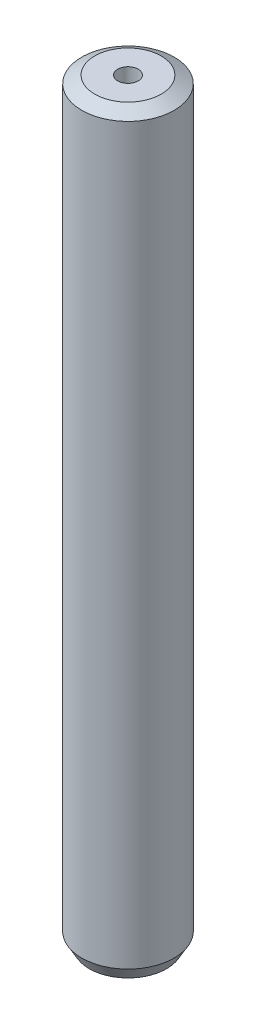
from build123d import *
from OCP.BRepFilletAPI import BRepFilletAPI_MakeChamfer

# Parameters (mm, degrees)
SKETCH1_R           = 7.5
BOSS_EXTRUDE1_DEPTH = 122.534306762
SKETCH2_R           = 1.661700774
CUT_EXTRUDE1_DEPTH  = 123.992505193
CHAMFER1_SIZE       = 1.219381404
CHAMFER1_SIZE2      = 2.112030545


with BuildPart() as part:
    # Sketch1 → Boss-Extrude1 (new body)
    with BuildSketch(Plane(origin=(0, 0, 0), x_dir=(1, 0, 0), z_dir=(0, 1, 0))):
        Circle(SKETCH1_R)
    extrude(amount=BOSS_EXTRUDE1_DEPTH)

    # Sketch2 → Cut-Extrude1 (cut, through all)
    with BuildSketch(Plane(origin=(0, 0, 0), x_dir=(1, 0, 0), z_dir=(0, 1, 0))):
        Circle(SKETCH2_R)
    extrude(amount=CUT_EXTRUDE1_DEPTH, mode=Mode.SUBTRACT)

    # Chamfer1: one chamfer whose edges measure the first distance from different faces: ONE call of the kernel's chamfer builder (chamfer() names one face for all edges)
    chamfer1_edges_1 = [part.edges().sort_by_distance(p)[0] for p in [
        (-7.5, 122.534306762, 0),
    ]]
    chamfer1_side_1 = [part.faces().sort_by_distance(p)[0] for p in [
        (-7.5, 61.267153381, 0),
    ]]
    chamfer1_edges_2 = [part.edges().sort_by_distance(p)[0] for p in [
        (-7.5, 0, 0),
    ]]
    chamfer1_side_2 = [part.faces().sort_by_distance(p)[0] for p in [
        (-7.287867966, 0, 0),
    ]]
    chamfer1 = BRepFilletAPI_MakeChamfer(part.part.solid().wrapped)
    for e in chamfer1_edges_1:
        chamfer1.Add(CHAMFER1_SIZE, CHAMFER1_SIZE2, e.wrapped, chamfer1_side_1[0].wrapped)  # the first distance lies on this face
    for e in chamfer1_edges_2:
        chamfer1.Add(CHAMFER1_SIZE, CHAMFER1_SIZE2, e.wrapped, chamfer1_side_2[0].wrapped)  # the first distance lies on this face
    add(Compound.cast(chamfer1.Shape()), mode=Mode.REPLACE)


solid = part.part
